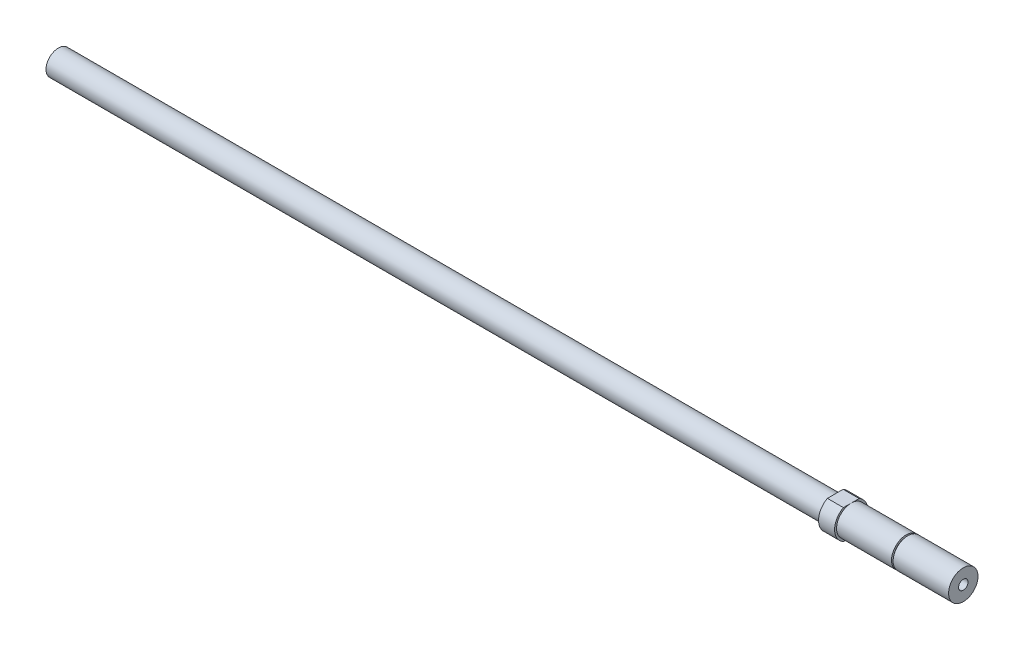
from build123d import *

# Parameters (mm, degrees)
SKETCH2_OUTSIDE_W         = 53.074
SKETCH2_OUTSIDE_H         = 53.074
SKETCH2_OUTSIDE_W_2       = 7.9375
SKETCH2_OUTSIDE_H_2       = 7
CUT_EXTRUDE1_DEPTH        = 216.465114617
F_4_40_TAPPED_HOLE1_D     = 2.2606
F_4_40_TAPPED_HOLE1_DEPTH = 7.62
F_4_40_TAPPED_HOLE1_TIP   = 0.679152758


with BuildPart() as part:
    # Sketch1 → Revolve1 (revolve)
    with BuildSketch(Plane.XY):
        Polygon((0, 0), (-215.392, 0), (-215.392, 2.95), (-30.48, 2.95), (-30.48, 3.96875), (-26.67, 3.96875), (-26.67, 3.5), (-13.589, 3.5), (-13.589, 3.0226), (-13.208, 3.0226), (-13.208, 3.5), (0, 3.5), align=None)
    revolve(axis=Axis((0, 0, 0), (-1, 0, 0)))

    # Sketch2 outside → Cut-Extrude1 (cut, through all)
    with BuildSketch(Plane(origin=(0, 0, 0), x_dir=(0, 0, -1), z_dir=(1, 0, 0))):
        Rectangle(SKETCH2_OUTSIDE_W, SKETCH2_OUTSIDE_H)
        Rectangle(SKETCH2_OUTSIDE_W_2, SKETCH2_OUTSIDE_H_2, mode=Mode.SUBTRACT)
    extrude(amount=-CUT_EXTRUDE1_DEPTH, mode=Mode.SUBTRACT)

    # #4-40 Tapped Hole1
    with Locations(Plane(origin=(0, 0, 0), x_dir=(0, 0, -1), z_dir=(1, 0, 0))):
        with Locations((0, 0)):
            Hole(F_4_40_TAPPED_HOLE1_D / 2, depth=F_4_40_TAPPED_HOLE1_DEPTH)
            with Locations((0, 0, -(F_4_40_TAPPED_HOLE1_DEPTH + F_4_40_TAPPED_HOLE1_TIP / 2))):  # 118° drill point
                Cone(0, F_4_40_TAPPED_HOLE1_D / 2, F_4_40_TAPPED_HOLE1_TIP, mode=Mode.SUBTRACT)


solid = part.part
